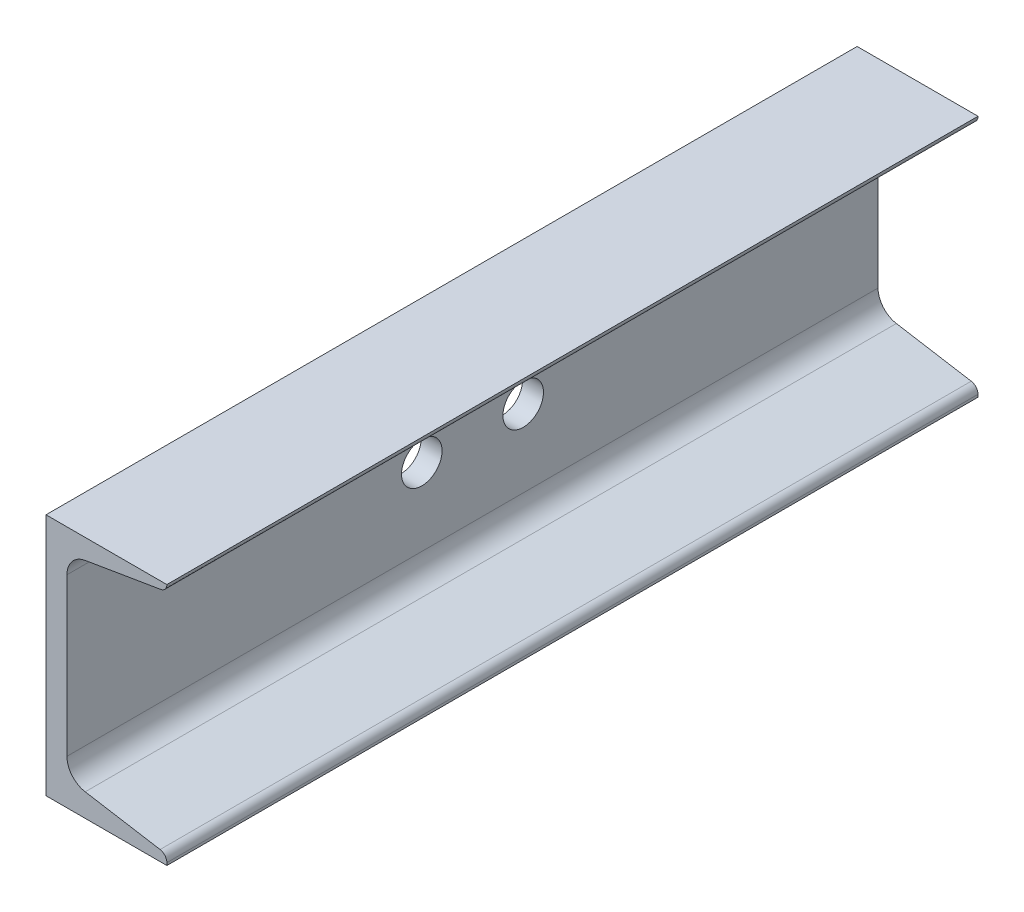
from build123d import *

# Parameters (mm, degrees)
BOSS_EXTRUDE1_DEPTH = 127
CUT_EXTRUDE1_REACH  = 139.887
SKETCH3_R           = 6.35


with BuildPart() as part:
    # Sketch1 → Boss-Extrude1 (new, symmetric)
    with BuildSketch(Plane.XY):
        with BuildLine():
            Line((37.846, -38.1), (0, -38.1))
            Line((0, -38.1), (0, 38.1))
            Line((0, 38.1), (37.846, 38.1))
            Line((37.846, 38.1), (37.846, 38.095373852))
            Line((37.846, 38.095373852), (37.846, 38.07919906))
            ThreePointArc((37.846, 38.07919906), (37.304749426, 36.602159643), (35.937298827, 35.824550175))
            Line((35.937298827, 35.824550175), (12.279303519, 31.865559515))
            ThreePointArc((12.279303519, 31.865559515), (8.176951722, 29.532731112), (6.5532, 25.101612859))
            Line((6.5532, 25.101612859), (6.5532, -24.125928831))
            ThreePointArc((6.5532, -24.125928831), (8.176951722, -28.557047083), (12.279303519, -30.889875486))
            Line((12.279303519, -30.889875486), (35.725220919, -34.813376476))
            ThreePointArc((35.725220919, -34.813376476), (37.244610473, -35.677386996), (37.846, -37.318541904))
            Line((37.846, -37.318541904), (37.846, -38.1))
        make_face()
    extrude(amount=BOSS_EXTRUDE1_DEPTH, both=True)

    # Sketch3 → Cut-Extrude1 (cut, up to next)
    with BuildSketch(Plane.ZY, mode=Mode.PRIVATE) as cut_extrude1_sk1:
        with Locations((-15.875, 0)):
            Circle(SKETCH3_R)
    cut_extrude1_tool1 = extrude(cut_extrude1_sk1.sketch, amount=-CUT_EXTRUDE1_REACH, mode=Mode.PRIVATE) & part.part
    # Sketch3 → Cut-Extrude1 (cut, up to next)
    with BuildSketch(Plane.ZY, mode=Mode.PRIVATE) as cut_extrude1_sk2:
        with Locations((15.875, 0)):
            Circle(SKETCH3_R)
    cut_extrude1_tool2 = extrude(cut_extrude1_sk2.sketch, amount=-CUT_EXTRUDE1_REACH, mode=Mode.PRIVATE) & part.part
    add(cut_extrude1_tool1.solids().sort_by_distance((0, 0, -15.875))[0], mode=Mode.SUBTRACT)
    add(cut_extrude1_tool2.solids().sort_by_distance((0, 0, 15.875))[0], mode=Mode.SUBTRACT)


solid = part.part
